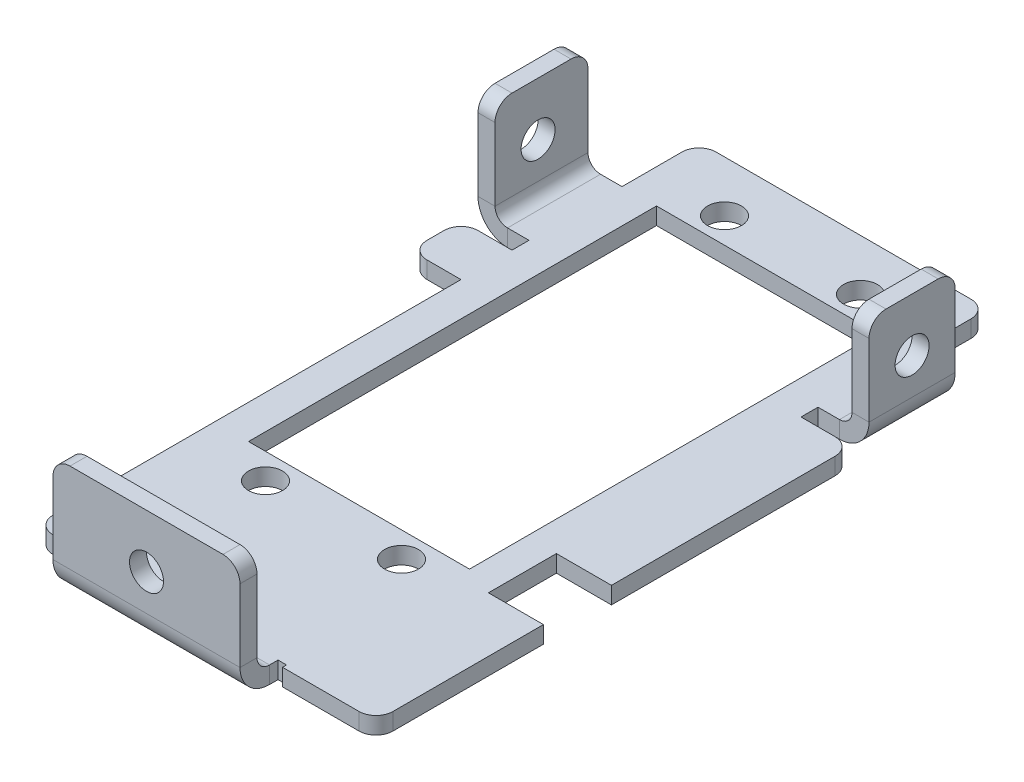
from build123d import *

# Parameters (mm, degrees)
SKETCH1_W                = 23
SKETCH1_H                = 50
BASE_FLANGE1_DEPTH       = 1
SKETCH8_W                = 13
SKETCH8_H                = 24
CUT_EXTRUDE2_DEPTH       = 56.045435778
SKETCH9_W                = 17
SKETCH9_H                = 9
SKETCH9_W_2              = 3
SKETCH9_H_2              = 1
SKETCH9_H_3              = 25
SKETCH9_W_3              = 6
SKETCH9_H_4              = 2
CUT_EXTRUDE3_DEPTH       = 56.045435778
EDGE_FLANGE1_START       = -36.069185562
EDGE_FLANGE1_DEPTH       = 5.069185562
EDGE_FLANGE1_START_2     = -36.470498128
EDGE_FLANGE1_2_DEPTH     = 0.401312566
EDGE_FLANGE1_START_3     = 6
EDGE_FLANGE1_3_DEPTH     = 11
EDGE_FLANGE1_4_DEPTH     = 5.470498128
EDGE_FLANGE1_START_4     = -2.2366
EDGE_FLANGE1_5_OUTLINE_W = 0.5
EDGE_FLANGE1_5_OUTLINE_H = 1
EDGE_FLANGE1_5_DEPTH     = 0.2366
EDGE_FLANGE1_6_DEPTH     = 11
FILLET1_R                = 1
SKETCH19_W               = 4.427639712
SKETCH19_H               = 4
CUT_EXTRUDE4_DEPTH       = 48.528938553
SKETCH20_R               = 1
CUT_EXTRUDE5_DEPTH       = 48.528938553
SKETCH21_R               = 1
CUT_EXTRUDE6_DEPTH       = 10
CUT_EXTRUDE7_DEPTH       = 47.914816423
CUT_EXTRUDE7_DEPTH_BACK  = 10
SKETCH22_R               = 1
FILLET2_R                = 1


# Read off the part's stored shape, not the designer's step: Edge-Flange1
# Sheet-metal steps are written as plain solids
with BuildPart() as part:
    # Sketch1 → Base-Flange1 (new body)
    with BuildSketch(Plane(origin=(0, 0, 0), x_dir=(1, 0, 0), z_dir=(0, 1, 0))):
        with Locations((11.5, 25)):
            Rectangle(SKETCH1_W, SKETCH1_H)
    extrude(amount=-BASE_FLANGE1_DEPTH)

    # Sketch8 → Cut-Extrude2 (cut, through all)
    with BuildSketch(Plane.XZ.offset(1)):
        with Locations((11.5, -24.5)):
            Rectangle(SKETCH8_W, SKETCH8_H)
    extrude(amount=-CUT_EXTRUDE2_DEPTH, mode=Mode.SUBTRACT)

    # Sketch9 → Cut-Extrude3 (cut, through all)
    with BuildSketch(Plane.XZ.offset(1)):
        with Locations((11.5, -45.5)):
            Rectangle(SKETCH9_W, SKETCH9_H)
        Polygon((0, -50), (3, -50), (3, -41), (3, -36.470498128), (0, -36.470498128), align=None)
        Polygon((23, -50), (23, -36.069185562), (20, -36.069185562), (20, -41), (20, -50), align=None)
        with Locations((21.5, -30.5)):
            Rectangle(SKETCH9_W_2, SKETCH9_H_2)
        with Locations((1.5, -30.5)):
            Rectangle(SKETCH9_W_2, SKETCH9_H_2)
        with Locations((1.5, -14.5)):
            Rectangle(SKETCH9_W_2, SKETCH9_H_3)
        with Locations((20, -1)):
            Rectangle(SKETCH9_W_3, SKETCH9_H_4)
        with Locations((4.5, -1)):
            Rectangle(SKETCH9_W_2, SKETCH9_H_4)
        with Locations((1.5, -1)):
            Rectangle(SKETCH9_W_2, SKETCH9_H_4)
    extrude(amount=-CUT_EXTRUDE3_DEPTH, mode=Mode.SUBTRACT)

    # Edge-Flange1 outline → Edge-Flange1 (add)
    with BuildSketch(Plane.XY.offset(EDGE_FLANGE1_START)):
        with BuildLine():
            Line((23, 0.7366), (23, 6))
            Line((23, 6), (22, 6))
            Line((22, 6), (22, 0.7366))
            ThreePointArc((22, 0.7366), (21.784254855, 0.215745145), (21.2634, 0))
            Line((21.2634, 0), (22.83604109, 0))
            ThreePointArc((22.83604109, 0), (22.958514757, 0.359286442), (23, 0.7366))
        make_face()
        with BuildLine():
            Line((0.16395891, 0), (1.7366, 0))
            ThreePointArc((1.7366, 0), (1.215745145, 0.215745145), (1, 0.7366))
            Line((1, 0.7366), (1, 6))
            Line((1, 6), (0, 6))
            Line((0, 6), (0, 0.7366))
            ThreePointArc((0, 0.7366), (0.041485243, 0.359286442), (0.16395891, 0))
        make_face()
    extrude(amount=EDGE_FLANGE1_DEPTH)

    # Edge-Flange1 2 outline → Edge-Flange1 2 (add)
    with BuildSketch(Plane.XY.offset(EDGE_FLANGE1_START_2)):
        with BuildLine():
            Line((0.16395891, 0), (1.7366, 0))
            ThreePointArc((1.7366, 0), (1.215745145, 0.215745145), (1, 0.7366))
            Line((1, 0.7366), (1, 6))
            Line((1, 6), (0, 6))
            Line((0, 6), (0, 0.7366))
            ThreePointArc((0, 0.7366), (0.041485243, 0.359286442), (0.16395891, 0))
        make_face()
    extrude(amount=EDGE_FLANGE1_2_DEPTH)

    # Edge-Flange1 3 outline → Edge-Flange1 3 (add)
    with BuildSketch(Plane.YZ.offset(EDGE_FLANGE1_START_3)):
        with BuildLine():
            Line((6, 0), (0.7366, 0))
            ThreePointArc((0.7366, 0), (0.359286442, -0.041485243), (0, -0.16395891))
            Line((0, -0.16395891), (0, -1.7366))
            ThreePointArc((0, -1.7366), (0.215745145, -1.215745145), (0.7366, -1))
            Line((0.7366, -1), (6, -1))
            Line((6, -1), (6, 0))
        make_face()
    extrude(amount=EDGE_FLANGE1_3_DEPTH)

    # Edge-Flange1 4 outline → Edge-Flange1 4 (cut)
    with BuildSketch(Plane.XY.offset(EDGE_FLANGE1_START_2)):
        with BuildLine():
            Line((23, 0), (22.83604109, 0))
            ThreePointArc((22.83604109, 0), (22.195226164, -0.728828115), (21.2634, -1))
            Line((21.2634, -1), (23, -1))
            Line((23, -1), (23, 0))
        make_face()
        with BuildLine():
            Line((0, -1), (1.7366, -1))
            ThreePointArc((1.7366, -1), (0.804773836, -0.728828115), (0.16395891, 0))
            Line((0.16395891, 0), (0, 0))
            Line((0, 0), (0, -1))
        make_face()
    extrude(amount=EDGE_FLANGE1_4_DEPTH, mode=Mode.SUBTRACT)

    # Edge-Flange1 5 outline → Edge-Flange1 5 (cut)
    with BuildSketch(Plane.XY.offset(EDGE_FLANGE1_START_4)):
        with Locations((17.25, -0.5)):
            Rectangle(EDGE_FLANGE1_5_OUTLINE_W, EDGE_FLANGE1_5_OUTLINE_H)
        with Locations((5.75, -0.5)):
            Rectangle(EDGE_FLANGE1_5_OUTLINE_W, EDGE_FLANGE1_5_OUTLINE_H)
    extrude(amount=EDGE_FLANGE1_5_DEPTH, mode=Mode.SUBTRACT)

    # Edge-Flange1 6 outline → Edge-Flange1 6 (cut)
    with BuildSketch(Plane.YZ.offset(EDGE_FLANGE1_START_3)):
        with BuildLine():
            ThreePointArc((-1, -1.7366), (-0.728828115, -0.804773836), (0, -0.16395891))
            Line((0, -0.16395891), (0, 0))
            Line((0, 0), (-1, 0))
            Line((-1, 0), (-1, -1.7366))
        make_face()
    extrude(amount=EDGE_FLANGE1_6_DEPTH, mode=Mode.SUBTRACT)

    # Fillet1
    fillet1_edges = [part.edges().sort_by_distance(p)[0] for p in [
        (3, -0.5, -2),
        (0, -0.5, -27),
        (6, 6, -0.5),
        (17, 6, -0.5),
        (0.5, 6, -36.470498128),
        (0.5, 6, -31),
        (22.5, 6, -31),
        (22.5, 6, -36.069185562),
        (23, -0.5, -30),
        (0, -0.5, -30),
        (23, -0.5, -2),
    ]]
    fillet(fillet1_edges, radius=FILLET1_R)

    # Sketch19 → Cut-Extrude4 (cut, through all)
    with BuildSketch(Plane.XZ.offset(1)):
        with Locations((21.977182604, -13.849068818)):
            Rectangle(SKETCH19_W, SKETCH19_H)
    extrude(amount=-CUT_EXTRUDE4_DEPTH, mode=Mode.SUBTRACT)

    # Sketch20 → Cut-Extrude5 (cut, through all)
    with BuildSketch(Plane.XZ.offset(1)):
        with Locations(Location((7.5, -11, 0), (0, 0, 270))):
            Circle(SKETCH20_R)
        with Locations(Location((15.5, -11, 0), (0, 0, 270))):
            Circle(SKETCH20_R)
        with Locations(Location((7.5, -38, 0), (0, 0, 270))):
            Circle(SKETCH20_R)
        with Locations(Location((15.5, -38, 0), (0, 0, 270))):
            Circle(SKETCH20_R)
    extrude(amount=-CUT_EXTRUDE5_DEPTH, mode=Mode.SUBTRACT)

    # Sketch21 → Cut-Extrude6 (cut)
    with BuildSketch(Plane(origin=(0, 0, -1), x_dir=(-1, 0, 0), z_dir=(0, 0, -1))):
        with Locations((-11.5, 2.8683)):
            Circle(SKETCH21_R)
    extrude(amount=-CUT_EXTRUDE6_DEPTH, mode=Mode.SUBTRACT)

    # Sketch22 → Cut-Extrude7 (cut, two sides: drawn at the far end of the back side and taken through both)
    with BuildSketch(Plane.ZY.offset(-22).offset(-CUT_EXTRUDE7_DEPTH_BACK)):
        with Locations(Location((-33.534592781, 2.8683, 0), (0, 0, 90))):
            Circle(SKETCH22_R)
    extrude(amount=CUT_EXTRUDE7_DEPTH + CUT_EXTRUDE7_DEPTH_BACK, mode=Mode.SUBTRACT)

    # Fillet2
    fillet2_edges = [part.edges().sort_by_distance(p)[0] for p in [
        (3, -0.5, -41),
        (20, -0.5, -41),
    ]]
    fillet(fillet2_edges, radius=FILLET2_R)


solid = part.part
